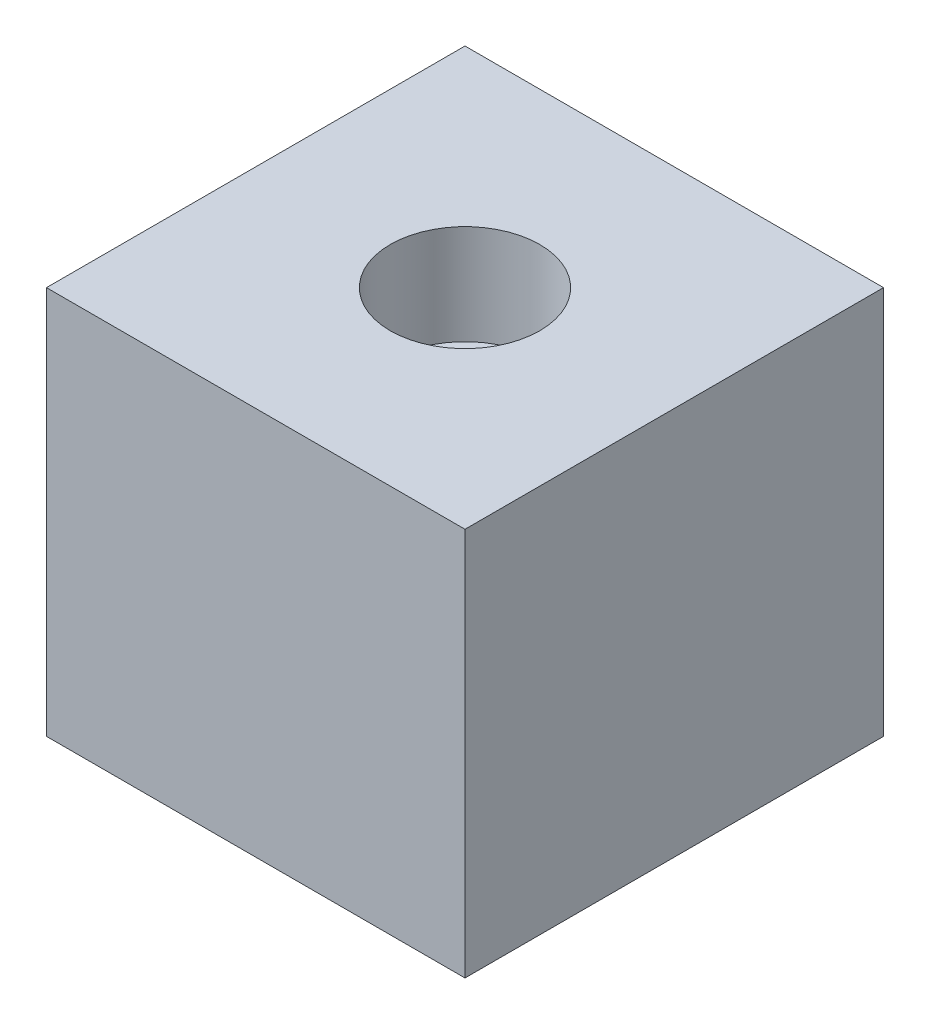
from build123d import *

# Parameters (mm, degrees)
ESQUISSE1_W             = 42
ESQUISSE1_H             = 42
BOSS_EXTRU_1_DEPTH      = 39
ESQUISSE3_R             = 7.5
ENL_V_MAT_EXTRU_2_DEPTH = 10


with BuildPart() as part:
    # Esquisse1 → Boss.-Extru.1 (new body)
    with BuildSketch(Plane(origin=(0, 0, 0), x_dir=(1, 0, 0), z_dir=(0, 1, 0))):
        Rectangle(ESQUISSE1_W, ESQUISSE1_H)
    extrude(amount=BOSS_EXTRU_1_DEPTH)

    # Esquisse3 → Enlèv. mat.-Extru.2 (cut)
    with BuildSketch(Plane(origin=(0, 39, 0), x_dir=(1, 0, 0), z_dir=(0, 1, 0))):
        Circle(ESQUISSE3_R)
    extrude(amount=-ENL_V_MAT_EXTRU_2_DEPTH, mode=Mode.SUBTRACT)


solid = part.part
